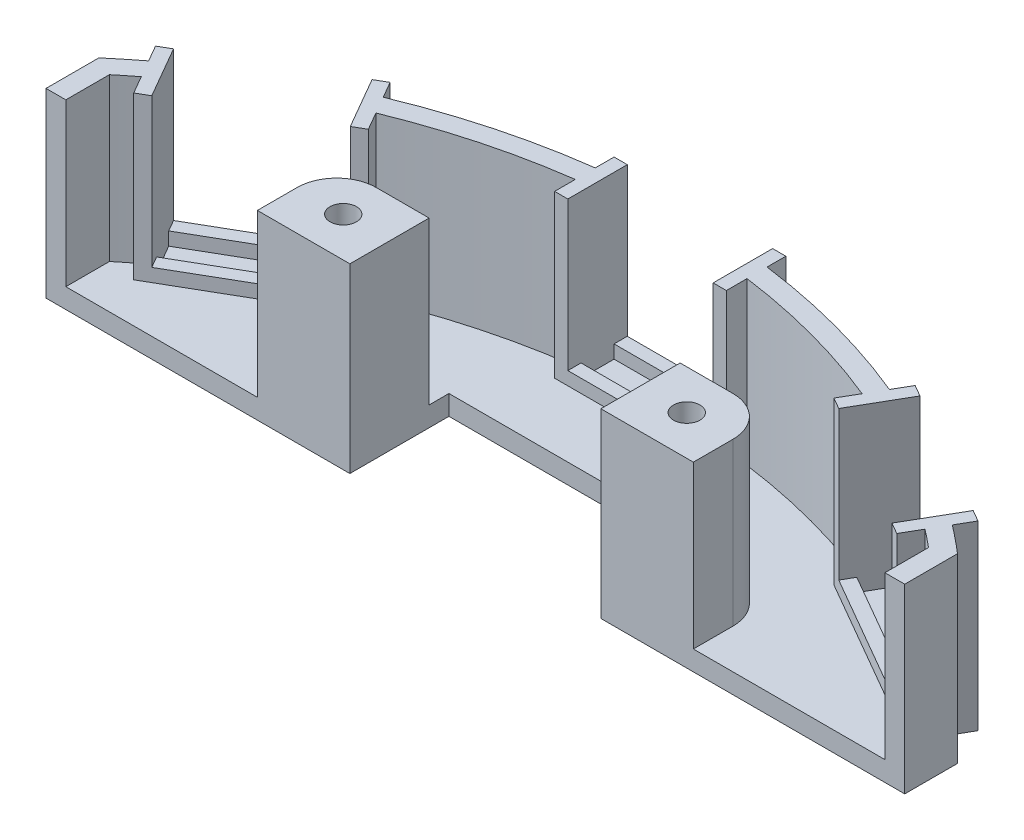
from build123d import *

# Parameters (mm, degrees)
EXTRUDE_1795_DEPTH     = 3
EXTRUDE_START          = 24.5
SKETCH_5_W             = 14
SKETCH_5_H             = 12
EXTRUDE_3571_DEPTH     = 24.5
SKETCH_8_W             = 22
SKETCH_8_H             = 9
CUT_EXTRUDE_4438_DEPTH = 22.5
SKETCH_9_W             = 22
SKETCH_9_H             = 5
CUT_EXTRUDE_4843_DEPTH = 2
SKETCH_6_R             = 2
CUT_EXTRUDE_5283_DEPTH = 125.037292779
FILLET_2_R             = 6


with BuildPart() as part:
    # 草图1 → Extrude 1795 (new body)
    with BuildSketch(Plane(origin=(0, 0, 0), x_dir=(1, 0, 0), z_dir=(0, 1, 0))):
        with BuildLine():
            Line((-65, 75.993420768), (-65, 68))
            Line((-65, 68), (-19, 68))
            Line((-19, 68), (-19, 83))
            Line((-19, 83), (19, 83))
            Line((19, 83), (19, 68))
            Line((19, 68), (65, 68))
            Line((65, 68), (65, 75.993420768))
            ThreePointArc((65, 75.993420768), (62.939630568, 77.708448086), (60.834029942, 79.367630688))
            Line((60.834029942, 79.367630688), (62.258330249, 81.834591186))
            Line((62.258330249, 81.834591186), (39.741669751, 94.834591186))
            Line((39.741669751, 94.834591186), (38.317369443, 92.367630688))
            ThreePointArc((38.317369443, 92.367630688), (25.88190451, 96.592582629), (13, 99.151399385))
            Line((13, 99.151399385), (13, 102))
            Line((13, 102), (-13, 102))
            Line((-13, 102), (-13, 99.151399385))
            ThreePointArc((-13, 99.151399385), (-25.88190451, 96.592582629), (-38.317369443, 92.367630688))
            Line((-38.317369443, 92.367630688), (-39.741669751, 94.834591186))
            Line((-39.741669751, 94.834591186), (-62.258330249, 81.834591186))
            Line((-62.258330249, 81.834591186), (-60.834029942, 79.367630688))
            ThreePointArc((-60.834029942, 79.367630688), (-62.939630568, 77.708448086), (-65, 75.993420768))
        make_face()
    extrude(amount=-EXTRUDE_1795_DEPTH)

    # 草图5 → Extrude 3571 (add)
    with BuildSketch(Plane(origin=(0, 0, 0), x_dir=(1, 0, 0), z_dir=(0, 1, 0)).offset(EXTRUDE_START)):
        with Locations((-26, 74)):
            Rectangle(SKETCH_5_W, SKETCH_5_H)
        with Locations((26, 74)):
            Rectangle(SKETCH_5_W, SKETCH_5_H)
        with BuildLine():
            Line((-13, 93), (13, 93))
            Line((13, 93), (13, 96.124918726))
            ThreePointArc((13, 96.124918726), (25.105447375, 93.69480515), (36.804129114, 89.746621553))
            Line((36.804129114, 89.746621553), (35.241669751, 87.040362552))
            Line((35.241669751, 87.040362552), (57.758330249, 74.040362552))
            Line((57.758330249, 74.040362552), (59.320789612, 76.746621553))
            ThreePointArc((59.320789612, 76.746621553), (60.669899006, 75.684630901), (62, 74.598927606))
            Line((62, 74.598927606), (62, 68))
            Line((62, 68), (65, 68))
            Line((65, 68), (65, 75.993420768))
            ThreePointArc((65, 75.993420768), (62.939630568, 77.708448086), (60.834029942, 79.367630688))
            Line((60.834029942, 79.367630688), (62.258330249, 81.834591186))
            Line((62.258330249, 81.834591186), (39.741669751, 94.834591186))
            Line((39.741669751, 94.834591186), (38.317369443, 92.367630688))
            ThreePointArc((38.317369443, 92.367630688), (25.88190451, 96.592582629), (13, 99.151399385))
            Line((13, 99.151399385), (13, 102))
            Line((13, 102), (-13, 102))
            Line((-13, 102), (-13, 99.151399385))
            ThreePointArc((-13, 99.151399385), (-25.88190451, 96.592582629), (-38.317369443, 92.367630688))
            Line((-38.317369443, 92.367630688), (-39.741669751, 94.834591186))
            Line((-39.741669751, 94.834591186), (-62.258330249, 81.834591186))
            Line((-62.258330249, 81.834591186), (-60.834029942, 79.367630688))
            ThreePointArc((-60.834029942, 79.367630688), (-62.939630568, 77.708448086), (-65, 75.993420768))
            Line((-65, 75.993420768), (-65, 68))
            Line((-65, 68), (-62, 68))
            Line((-62, 68), (-62, 74.598927606))
            ThreePointArc((-62, 74.598927606), (-60.669899006, 75.684630901), (-59.320789612, 76.746621553))
            Line((-59.320789612, 76.746621553), (-57.758330249, 74.040362552))
            Line((-57.758330249, 74.040362552), (-35.241669751, 87.040362552))
            Line((-35.241669751, 87.040362552), (-36.804129114, 89.746621553))
            ThreePointArc((-36.804129114, 89.746621553), (-25.105447375, 93.69480515), (-13, 96.124918726))
            Line((-13, 96.124918726), (-13, 93))
        make_face()
    extrude(amount=-EXTRUDE_3571_DEPTH)

    # 草图8 → Cut-Extrude 4438 (cut)
    with BuildSketch(Plane(origin=(0, 24.5, 0), x_dir=(1, 0, 0), z_dir=(0, 1, 0))):
        Polygon((-36.973720558, 86.040362552), (-56.026279442, 75.040362552), (-60.526279442, 82.834591186), (-41.473720558, 93.834591186), align=None)
        with Locations((0, 97.5)):
            Rectangle(SKETCH_8_W, SKETCH_8_H)
        Polygon((36.973720558, 86.040362552), (56.026279442, 75.040362552), (60.526279442, 82.834591186), (41.473720558, 93.834591186), align=None)
    extrude(amount=-CUT_EXTRUDE_4438_DEPTH, mode=Mode.SUBTRACT)

    # 草图9 → Cut-Extrude 4843 (cut)
    with BuildSketch(Plane(origin=(0, 2, 0), x_dir=(1, 0, 0), z_dir=(0, 1, 0))):
        Polygon((-59.526279442, 81.102540378), (-40.473720558, 92.102540378), (-37.973720558, 87.77241336), (-57.026279442, 76.77241336), align=None)
        with Locations((0, 97.5)):
            Rectangle(SKETCH_9_W, SKETCH_9_H)
        Polygon((40.473720558, 92.102540378), (59.526279442, 81.102540378), (57.026279442, 76.77241336), (37.973720558, 87.77241336), align=None)
    extrude(amount=-CUT_EXTRUDE_4843_DEPTH, mode=Mode.SUBTRACT)

    # 草图6 → Cut-Extrude 5283 (cut, through all)
    with BuildSketch(Plane.XZ.offset(3)):
        with Locations((-26, -74)):
            Circle(SKETCH_6_R)
        with Locations((26, -74)):
            Circle(SKETCH_6_R)
    extrude(amount=-CUT_EXTRUDE_5283_DEPTH, mode=Mode.SUBTRACT)

    # 圆角2
    fillet_2_edges = [part.edges().sort_by_distance(p)[0] for p in [
        (-33, 12.25, -80),
        (33, 12.25, -80),
    ]]
    fillet(fillet_2_edges, radius=FILLET_2_R)


solid = part.part
